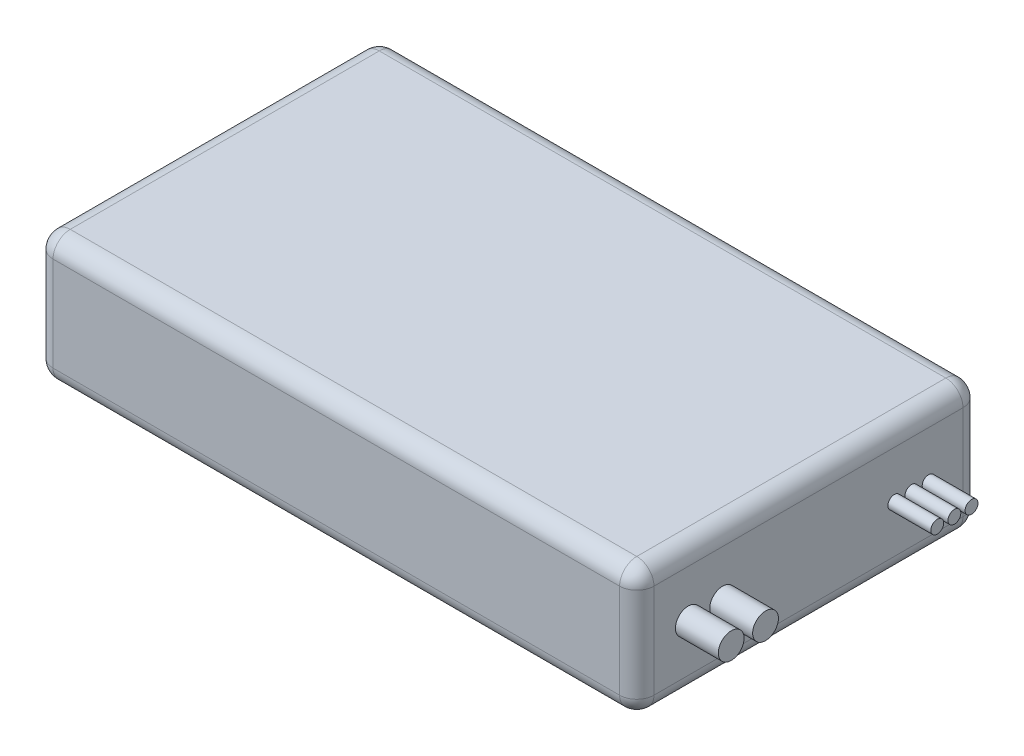
from build123d import *

# Parameters (mm, degrees)
ESQUISSE1_W      = 70
ESQUISSE1_H      = 40
EXTRUSION1_DEPTH = 15
CONG_1_R         = 2
ESQUISSE2_R      = 1.5
ESQUISSE2_R_2    = 0.75
EXTRUSION2_DEPTH = 5


with BuildPart() as part:
    # Esquisse1 → Extrusion1 (new body)
    with BuildSketch(Plane(origin=(0, 0, 0), x_dir=(1, 0, 0), z_dir=(0, 1, 0))):
        with Locations((35, 20)):
            Rectangle(ESQUISSE1_W, ESQUISSE1_H)
    extrude(amount=EXTRUSION1_DEPTH)

    # Congé1
    cong_1_edges = [part.edges().sort_by_distance(p)[0] for p in [
        (0, 0, -20),
        (35, 0, -40),
        (0, 7.5, -40),
        (0, 7.5, 0),
        (70, 7.5, 0),
        (70, 7.5, -40),
        (70, 0, -20),
        (70, 15, -20),
        (35, 15, -40),
        (0, 15, -20),
        (35, 0, 0),
        (35, 15, 0),
    ]]
    fillet(cong_1_edges, radius=CONG_1_R)

    # Esquisse2 → Extrusion2 (add)
    with BuildSketch(Plane(origin=(70, 0, 0), x_dir=(0, 0, -1), z_dir=(1, 0, 0))):
        with Locations((6, 7.5)):
            Circle(ESQUISSE2_R)
        with Locations((10, 7.5)):
            Circle(ESQUISSE2_R)
        with Locations((30, 7.5)):
            Circle(ESQUISSE2_R_2)
        with Locations((32, 7.5)):
            Circle(ESQUISSE2_R_2)
        with Locations((34, 7.5)):
            Circle(ESQUISSE2_R_2)
    extrude(amount=EXTRUSION2_DEPTH)


solid = part.part
